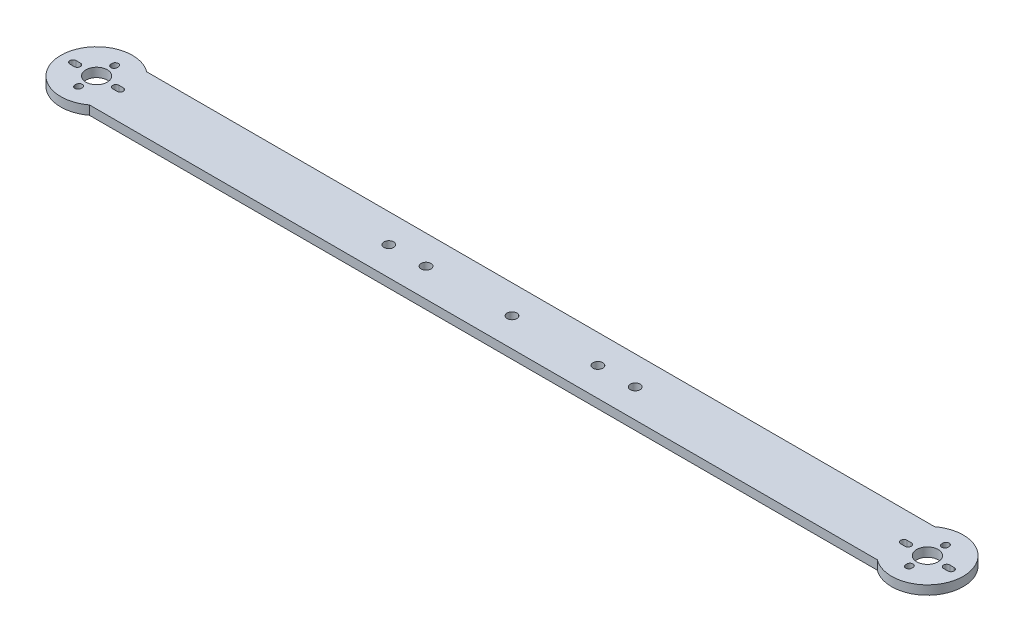
from build123d import *

# Parameters (mm, degrees)
BOSS_EXTRUDE1_DEPTH = 4
SKETCH2_R           = 4.75
CUT_EXTRUDE1_DEPTH  = 201.6938371
SKETCH3_R           = 2.159
CUT_EXTRUDE2_DEPTH  = 201.6938371
SKETCH4_R           = 2.159
CUT_EXTRUDE3_DEPTH  = 201.6938371


with BuildPart() as part:
    # Sketch1 → Boss-Extrude1 (new body)
    with BuildSketch(Plane(origin=(0, 0, 0), x_dir=(1, 0, 0), z_dir=(0, 1, 0))):
        with BuildLine():
            Line((-174.625, 12.7), (174.625, 12.7))
            ThreePointArc((174.625, 12.7), (200.025, 0), (174.625, -12.7))
            Line((174.625, -12.7), (-174.625, -12.7))
            ThreePointArc((-174.625, -12.7), (-200.025, 0), (-174.625, 12.7))
        make_face()
    extrude(amount=BOSS_EXTRUDE1_DEPTH)

    # Sketch2 → Cut-Extrude1 (cut, through all)
    with BuildSketch(Plane(origin=(0, 4, 0), x_dir=(1, 0, 0), z_dir=(0, 1, 0))):
        with Locations((184.15, 0)):
            Circle(SKETCH2_R)
        with Locations((-184.15, 0)):
            Circle(SKETCH2_R)
        with BuildLine():
            Line((173.691383345, 1.375), (175.608616655, 1.375))
            ThreePointArc((175.608616655, 1.375), (176.983616655, 0), (175.608616655, -1.375))
            Line((175.608616655, -1.375), (173.691383345, -1.375))
            ThreePointArc((173.691383345, -1.375), (172.316383345, 0), (173.691383345, 1.375))
        make_face()
        with BuildLine():
            Line((194.608616655, 1.375), (192.691383345, 1.375))
            ThreePointArc((192.691383345, 1.375), (191.316383345, 0), (192.691383345, -1.375))
            Line((192.691383345, -1.375), (194.608616655, -1.375))
            ThreePointArc((194.608616655, -1.375), (195.983616655, 0), (194.608616655, 1.375))
        make_face()
        with BuildLine():
            Line((185.525, 8.25), (185.525, 7.75))
            ThreePointArc((185.525, 7.75), (184.15, 6.375), (182.775, 7.75))
            Line((182.775, 7.75), (182.775, 8.25))
            ThreePointArc((182.775, 8.25), (184.15, 9.625), (185.525, 8.25))
        make_face()
        with BuildLine():
            Line((185.525, -8.25), (185.525, -7.75))
            ThreePointArc((185.525, -7.75), (184.15, -6.375), (182.775, -7.75))
            Line((182.775, -7.75), (182.775, -8.25))
            ThreePointArc((182.775, -8.25), (184.15, -9.625), (185.525, -8.25))
        make_face()
        with BuildLine():
            Line((-185.525, -8.25), (-185.525, -7.75))
            ThreePointArc((-185.525, -7.75), (-184.15, -6.375), (-182.775, -7.75))
            Line((-182.775, -7.75), (-182.775, -8.25))
            ThreePointArc((-182.775, -8.25), (-184.15, -9.625), (-185.525, -8.25))
        make_face()
        with BuildLine():
            Line((-185.525, 8.25), (-185.525, 7.75))
            ThreePointArc((-185.525, 7.75), (-184.15, 6.375), (-182.775, 7.75))
            Line((-182.775, 7.75), (-182.775, 8.25))
            ThreePointArc((-182.775, 8.25), (-184.15, 9.625), (-185.525, 8.25))
        make_face()
        with BuildLine():
            Line((-194.608616655, 1.375), (-192.691383345, 1.375))
            ThreePointArc((-192.691383345, 1.375), (-191.316383345, 0), (-192.691383345, -1.375))
            Line((-192.691383345, -1.375), (-194.608616655, -1.375))
            ThreePointArc((-194.608616655, -1.375), (-195.983616655, 0), (-194.608616655, 1.375))
        make_face()
        with BuildLine():
            Line((-173.691383345, 1.375), (-175.608616655, 1.375))
            ThreePointArc((-175.608616655, 1.375), (-176.983616655, 0), (-175.608616655, -1.375))
            Line((-175.608616655, -1.375), (-173.691383345, -1.375))
            ThreePointArc((-173.691383345, -1.375), (-172.316383345, 0), (-173.691383345, 1.375))
        make_face()
    extrude(amount=-CUT_EXTRUDE1_DEPTH, mode=Mode.SUBTRACT)

    # Sketch3 → Cut-Extrude2 (cut, through all)
    with BuildSketch(Plane(origin=(0, 4, 0), x_dir=(1, 0, 0), z_dir=(0, 1, 0))):
        Circle(SKETCH3_R)
        with Locations((38.1, 0)):
            Circle(SKETCH3_R)
        with Locations((-38.1, 0)):
            Circle(SKETCH3_R)
    extrude(amount=-CUT_EXTRUDE2_DEPTH, mode=Mode.SUBTRACT)

    # Sketch4 → Cut-Extrude3 (cut, through all)
    with BuildSketch(Plane(origin=(0, 4, 0), x_dir=(1, 0, 0), z_dir=(0, 1, 0))):
        with Locations((54.61, 0)):
            Circle(SKETCH4_R)
        with Locations((-54.61, 0)):
            Circle(SKETCH4_R)
    extrude(amount=-CUT_EXTRUDE3_DEPTH, mode=Mode.SUBTRACT)


solid = part.part
